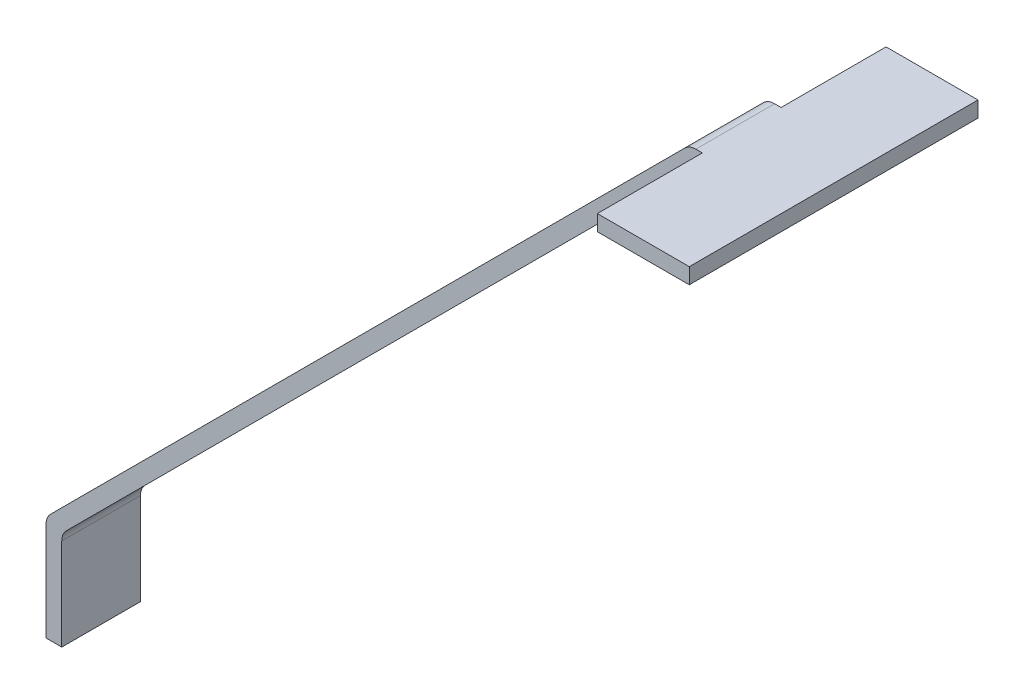
from build123d import *

# Parameters (mm, degrees)
BOSS_EXTRUDE1_DEPTH = 15
FILLET3_R           = 3
SKETCH3_W           = 17.514718626
SKETCH3_H           = 3
BOSS_EXTRUDE2_DEPTH = 20
SKETCH5_W           = 17.514718626
SKETCH5_H           = 3
BOSS_EXTRUDE3_DEPTH = 20


with BuildPart() as part:
    # Sketch2 → Boss-Extrude1 (new body)
    with BuildSketch(Plane.XY):
        Polygon((0, 0), (122.54160518, 122.54160518), (142.54160518, 122.54160518), (142.54160518, 119.54160518), (123.784245867, 119.54160518), (3, -1.242640687), (3, -20), (0, -20), align=None)
    extrude(amount=BOSS_EXTRUDE1_DEPTH)

    # Fillet3
    fillet3_edges = [part.edges().sort_by_distance(p)[0] for p in [
        (3, -1.242640687, 7.5),
        (0, 0, 7.5),
        (123.784245867, 119.54160518, 7.5),
        (122.54160518, 122.54160518, 7.5),
    ]]
    fillet(fillet3_edges, radius=FILLET3_R)

    # Sketch3 → Boss-Extrude2 (add)
    with BuildSketch(Plane.XY.offset(15)):
        with Locations((133.784245867, 121.04160518)):
            Rectangle(SKETCH3_W, SKETCH3_H)
    extrude(amount=BOSS_EXTRUDE2_DEPTH)

    # Sketch5 → Boss-Extrude3 (add)
    with BuildSketch(Plane(origin=(0, 0, 0), x_dir=(-1, 0, 0), z_dir=(0, 0, -1))):
        with Locations((-133.784245867, 121.04160518)):
            Rectangle(SKETCH5_W, SKETCH5_H)
    extrude(amount=BOSS_EXTRUDE3_DEPTH)


solid = part.part
